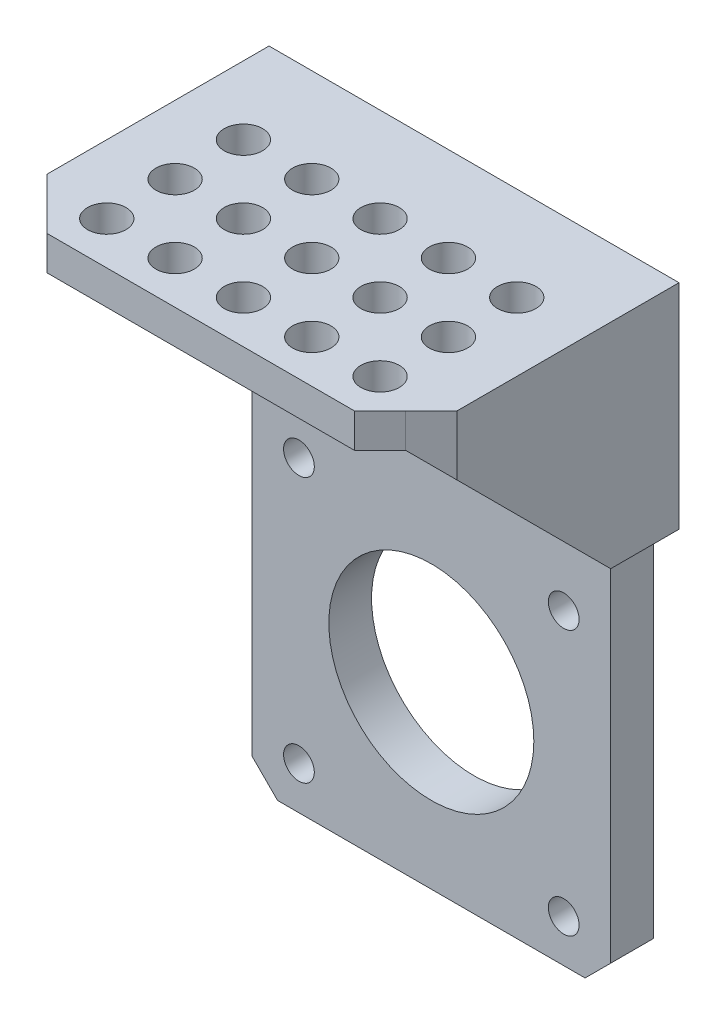
from build123d import *

# Parameters (mm, degrees)
SKETCH_1_R          = 1.8
SKETCH_1_R_2        = 12
EXTRUDE_1_DEPTH     = 5
SKETCH_4_W          = 42
SKETCH_4_H          = 4
EXTRUDE_2_DEPTH     = 27
SKETCH_5_R          = 2.25
CUT_EXTRUDE_1_DEPTH = 4
CHAMFER_1_SIZE      = 3
EXTRUDE_3_DEPTH     = 3
CHAMFER_2_SIZE      = 3


with BuildPart() as part:
    # 草图1 → 凸台-拉伸1 (new body)
    with BuildSketch(Plane.XY):
        Polygon((-21, 21), (-21, -21), (21, -21), (21, 21), (21, 50), (-21, 50), align=None)
        with Locations((-15.5, -16)):
            Circle(SKETCH_1_R, mode=Mode.SUBTRACT)
        with Locations((-15.5, 15)):
            Circle(SKETCH_1_R, mode=Mode.SUBTRACT)
        with Locations(Location((15.5, -16, 0), (0, 0, 180))):
            Circle(SKETCH_1_R, mode=Mode.SUBTRACT)
        with Locations(Location((15.5, 15, 0), (0, 0, 180))):
            Circle(SKETCH_1_R, mode=Mode.SUBTRACT)
        Circle(SKETCH_1_R_2, mode=Mode.SUBTRACT)
    extrude(amount=EXTRUDE_1_DEPTH)

    # 草图4 → 凸台-拉伸2 (add)
    with BuildSketch(Plane.XY.offset(5)):
        with Locations((0, 48)):
            Rectangle(SKETCH_4_W, SKETCH_4_H)
    extrude(amount=EXTRUDE_2_DEPTH)

    # 草图5 → 切除-拉伸1 (cut)
    with BuildSketch(Plane(origin=(0, 50, 0), x_dir=(1, 0, 0), z_dir=(0, 1, 0))):
        with Locations(Location((-16, -27, 0), (0, 0, 270))):
            Circle(SKETCH_5_R)
        with Locations(Location((-8, -27, 0), (0, 0, 270))):
            Circle(SKETCH_5_R)
        with Locations(Location((0, -27, 0), (0, 0, 270))):
            Circle(SKETCH_5_R)
        with Locations(Location((8, -27, 0), (0, 0, 270))):
            Circle(SKETCH_5_R)
        with Locations(Location((16, -27, 0), (0, 0, 270))):
            Circle(SKETCH_5_R)
        with Locations(Location((-16, -19, 0), (0, 0, 270))):
            Circle(SKETCH_5_R)
        with Locations(Location((-8, -19, 0), (0, 0, 270))):
            Circle(SKETCH_5_R)
        with Locations(Location((0, -19, 0), (0, 0, 270))):
            Circle(SKETCH_5_R)
        with Locations(Location((8, -19, 0), (0, 0, 270))):
            Circle(SKETCH_5_R)
        with Locations(Location((16, -19, 0), (0, 0, 270))):
            Circle(SKETCH_5_R)
        with Locations(Location((-16, -11, 0), (0, 0, 270))):
            Circle(SKETCH_5_R)
        with Locations(Location((-8, -11, 0), (0, 0, 270))):
            Circle(SKETCH_5_R)
        with Locations(Location((0, -11, 0), (0, 0, 270))):
            Circle(SKETCH_5_R)
        with Locations(Location((8, -11, 0), (0, 0, 270))):
            Circle(SKETCH_5_R)
        with Locations(Location((16, -11, 0), (0, 0, 270))):
            Circle(SKETCH_5_R)
    extrude(amount=-CUT_EXTRUDE_1_DEPTH, mode=Mode.SUBTRACT)

    # 倒角1
    chamfer_1_edges = [part.edges().sort_by_distance(p)[0] for p in [
        (21, -21, 2.5),
        (-21, -21, 2.5),
        (21, 48, 32),
        (-21, 48, 32),
    ]]
    chamfer(chamfer_1_edges, length=CHAMFER_1_SIZE)

    # 草图7 → 凸台-拉伸3 (add)
    with BuildSketch(Plane.ZY.offset(21)):
        Polygon((29, 46), (5, 22), (0, 22), (0, 50), (29, 50), align=None)
    extrude_3 = extrude(amount=EXTRUDE_3_DEPTH)

    # 镜向1: 凸台-拉伸3 across plane
    add(extrude_3.mirror(Plane(origin=(0, 0, 0), x_dir=(0, 0, 1), z_dir=(1, 0, 0))))

    # 倒角2
    chamfer_2_edges = [part.edges().sort_by_distance(p)[0] for p in [
        (24, 22, 2.5),
        (24, 48, 29),
        (-24, 48, 29),
        (-24, 22, 2.5),
    ]]
    chamfer(chamfer_2_edges, length=CHAMFER_2_SIZE - 0.0001)  # a hair under: the kernel refuses the full size


solid = part.part
